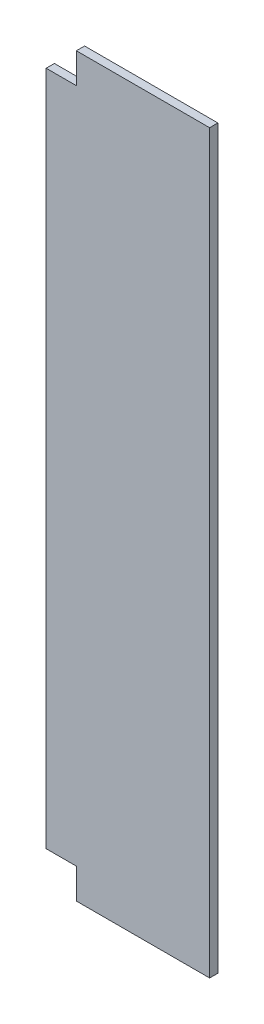
from build123d import *

# Parameters (mm, degrees)
BOSS_EXTRUDE1_DEPTH = 6


with BuildPart() as part:
    # Sketch1 → Boss-Extrude1 (new body)
    with BuildSketch(Plane.XY):
        Polygon((-107.569298917, -326.855738356), (-107.569298917, -304.855738356), (-129.569298917, -304.855738356), (-129.569298917, 187.144261644), (-107.569298917, 187.144261644), (-107.569298917, 209.144261644), (-10.569298917, 209.144261644), (-10.569298917, -326.855738356), align=None)
    extrude(amount=BOSS_EXTRUDE1_DEPTH)


solid = part.part
